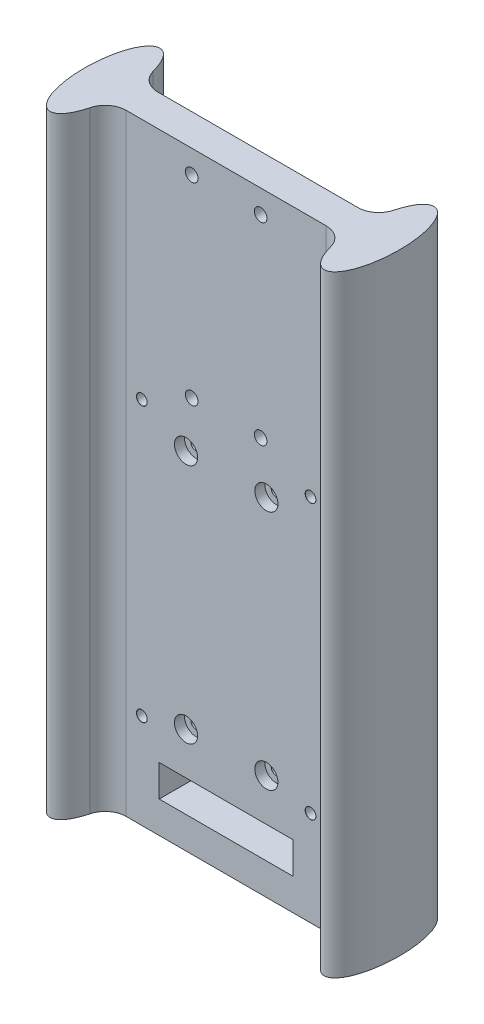
from build123d import *

# Parameters (mm, degrees)
BOSS_EXTRUDE1_DEPTH               = 145
FILLET1_R                         = 5
CUT_EXTRUDE2_DEPTH                = 151.667133244
CUT_EXTRUDE2_DEPTH_BACK           = 151.667133244
SKETCH3_W                         = 31.75
SKETCH3_H                         = 7.5
TAP_DRILL_FOR_M3X0_5_TAP1_D       = 2.5
SKETCH6_R                         = 2.75
CUT_EXTRUDE4_DEPTH                = 2.4
TAP_DRILL_FOR_M3_TAP1_D           = 2.5
TAP_DRILL_FOR_M3_TAP1_CSINK_D     = 2.55
TAP_DRILL_FOR_M3_TAP1_CSINK_ANGLE = 90
SKETCH9_R                         = 1.5
CUT_EXTRUDE5_DEPTH                = 151.667133244


with BuildPart() as part:
    # Sketch1 → Boss-Extrude1 (new body)
    with BuildSketch(Plane(origin=(0, 0, 0), x_dir=(1, 0, 0), z_dir=(0, 1, 0))):
        with BuildLine():
            add(Edge.make_bspline(
                [(27.856166305, -3.75), (30.638876861, -28.508062419), (36.392803395, -7.75403121), (42.146729928, 13), (32.5, 13)],
                knots=[1.863416012, 1.863416012, 1.863416012, 4.07330066, 4.07330066, 6.283185307, 6.283185307, 6.283185307], degree=2, weights=[1, 0.449185964, 1, 0.449185964, 1]))
            add(Edge.make_bspline(
                [(32.5, 13), (28.895830565, 13), (27.856166305, 3.75)],
                knots=[0, 0, 0, 1.278176641, 1.278176641, 1.278176641], degree=2, weights=[1, 0.802639875, 1]))
            Line((27.856166305, 3.75), (-27.856166305, 3.75))
            add(Edge.make_bspline(
                [(-27.856166305, 3.75), (-30.638876861, 28.508062419), (-36.392803395, 7.75403121), (-42.146729928, -13), (-32.5, -13)],
                knots=[1.863416012, 1.863416012, 1.863416012, 4.07330066, 4.07330066, 6.283185307, 6.283185307, 6.283185307], degree=2, weights=[1, 0.449185964, 1, 0.449185964, 1]))
            add(Edge.make_bspline(
                [(-32.5, -13), (-28.895830565, -13), (-27.856166305, -3.75)],
                knots=[0, 0, 0, 1.278176641, 1.278176641, 1.278176641], degree=2, weights=[1, 0.802639875, 1]))
            Line((-27.856166305, -3.75), (27.856166305, -3.75))
        make_face()
    extrude(amount=BOSS_EXTRUDE1_DEPTH)

    # Fillet1
    fillet1_edges = [part.edges().sort_by_distance(p)[0] for p in [
        (-27.856166305, 72.5, -3.75),
        (27.856166305, 72.5, -3.75),
        (27.856166305, 72.5, 3.75),
        (-27.856166305, 72.5, 3.75),
    ]]
    fillet(fillet1_edges, radius=FILLET1_R)

    # Sketch3 → Cut-Extrude2 (cut, two sides: drawn at the far end of the back side and taken through both)
    with BuildSketch(Plane(origin=(0, 0, -3.75), x_dir=(-1, 0, 0), z_dir=(0, 0, -1)).offset(-CUT_EXTRUDE2_DEPTH_BACK)):
        with Locations((0, 11.25)):
            Rectangle(SKETCH3_W, SKETCH3_H)
    extrude(amount=CUT_EXTRUDE2_DEPTH + CUT_EXTRUDE2_DEPTH_BACK, mode=Mode.SUBTRACT)

    # Tap Drill for M3x0.5 Tap1 (through all)
    with Locations(Plane(origin=(9.525, 82.15, -3.75), x_dir=(-1, 0, 0), z_dir=(0, 0, -1))):
        with Locations((0, 0), (19.05, 0), (19.05, -57.15), (0, -57.15)):
            Hole(TAP_DRILL_FOR_M3X0_5_TAP1_D / 2)

    # Sketch6 → Cut-Extrude4 (cut)
    with BuildSketch(Plane.XY.offset(3.75)):
        with Locations((9.525, 82.15)):
            Circle(SKETCH6_R)
        with Locations((-9.525, 82.15)):
            Circle(SKETCH6_R)
        with Locations((9.525, 25)):
            Circle(SKETCH6_R)
        with Locations((-9.525, 25)):
            Circle(SKETCH6_R)
    extrude(amount=-CUT_EXTRUDE4_DEPTH, mode=Mode.SUBTRACT)

    # Tap Drill for M3 Tap1 (through all)
    with Locations(Plane.XY.offset(3.75)):
        with Locations((-20, 87.5), (20, 87.5), (20, 22.5), (-20, 22.5)):
            CounterSinkHole(TAP_DRILL_FOR_M3_TAP1_D / 2, TAP_DRILL_FOR_M3_TAP1_CSINK_D / 2, counter_sink_angle=TAP_DRILL_FOR_M3_TAP1_CSINK_ANGLE)

    # Sketch9 → Cut-Extrude5 (cut, through all)
    with BuildSketch(Plane(origin=(0, 0, -3.75), x_dir=(-1, 0, 0), z_dir=(0, 0, -1))):
        with Locations((-8.168, 139.5)):
            Circle(SKETCH9_R)
        with Locations((-8.168, 93.7)):
            Circle(SKETCH9_R)
        with Locations((8.168, 93.7)):
            Circle(SKETCH9_R)
        with Locations((8.168, 139.5)):
            Circle(SKETCH9_R)
    extrude(amount=-CUT_EXTRUDE5_DEPTH, mode=Mode.SUBTRACT)


solid = part.part
